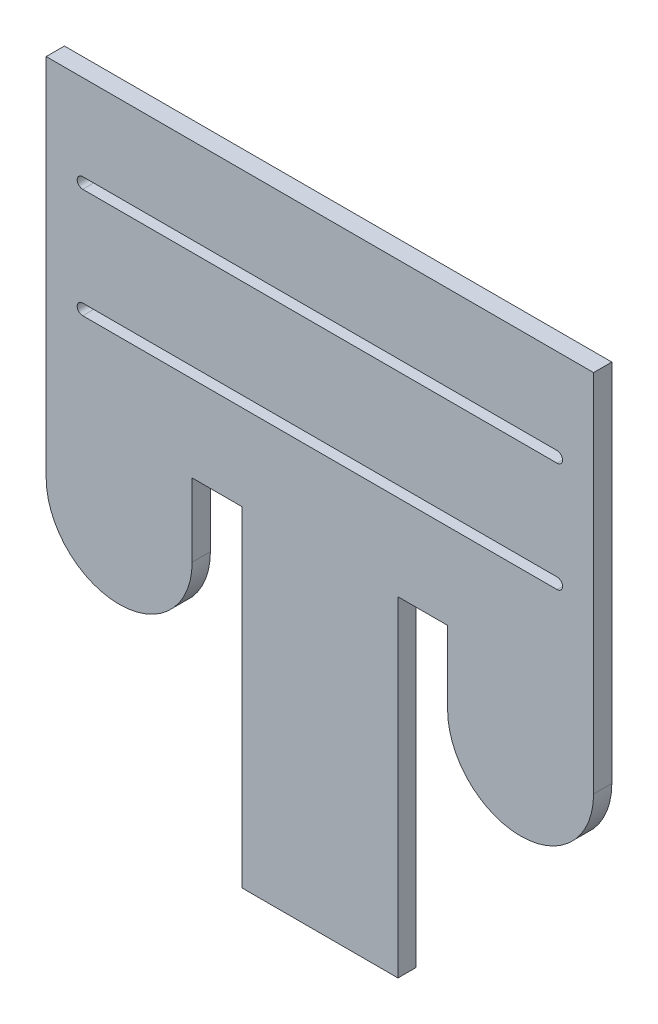
from build123d import *

# Parameters (mm, degrees)
SKETCH1_W           = 190.5
SKETCH1_H           = 6.35
BOSS_EXTRUDE1_DEPTH = 101.6
CUT_EXTRUDE1_DEPTH  = 216.993362167
SKETCH3_W           = 50.8
SKETCH3_H           = 50.8
BOSS_EXTRUDE2_DEPTH = 6.35
FILLET1_R           = 25.4
SKETCH4_W           = 54.356
SKETCH4_H           = 6.35
BOSS_EXTRUDE3_DEPTH = 114.9016


with BuildPart() as part:
    # Sketch1 → Boss-Extrude1 (new body)
    with BuildSketch(Plane(origin=(0, 0, 0), x_dir=(1, 0, 0), z_dir=(0, 1, 0))):
        with Locations((95.25, 3.175)):
            Rectangle(SKETCH1_W, SKETCH1_H)
    extrude(amount=BOSS_EXTRUDE1_DEPTH)

    # Sketch2 → Cut-Extrude1 (cut, through all)
    with BuildSketch(Plane(origin=(0, 0, -6.35), x_dir=(-1, 0, 0), z_dir=(0, 0, -1))):
        with BuildLine():
            Line((-177.8, 71.755), (-12.7, 71.755))
            ThreePointArc((-12.7, 71.755), (-10.795, 69.85), (-12.7, 67.945))
            Line((-12.7, 67.945), (-177.8, 67.945))
            ThreePointArc((-177.8, 67.945), (-179.705, 69.85), (-177.8, 71.755))
        make_face()
        with BuildLine():
            Line((-177.8, 33.655), (-12.7, 33.655))
            ThreePointArc((-12.7, 33.655), (-10.795, 31.75), (-12.7, 29.845))
            Line((-12.7, 29.845), (-177.8, 29.845))
            ThreePointArc((-177.8, 29.845), (-179.705, 31.75), (-177.8, 33.655))
        make_face()
    extrude(amount=-CUT_EXTRUDE1_DEPTH, mode=Mode.SUBTRACT)

    # Sketch3 → Boss-Extrude2 (add)
    with BuildSketch(Plane.XY):
        with Locations((25.4, -25.4)):
            Rectangle(SKETCH3_W, SKETCH3_H)
        with Locations((165.1, -25.4)):
            Rectangle(SKETCH3_W, SKETCH3_H)
    extrude(amount=-BOSS_EXTRUDE2_DEPTH)

    # Fillet1
    fillet1_edges = [part.edges().sort_by_distance(p)[0] for p in [
        (139.7, -50.8, -3.175),
        (0, -50.8, -3.175),
        (50.8, -50.8, -3.175),
        (190.5, -50.8, -3.175),
    ]]
    fillet(fillet1_edges, radius=FILLET1_R - 0.0001)  # a hair under: the kernel refuses the full size

    # Sketch4 → Boss-Extrude3 (add)
    with BuildSketch(Plane.XZ):
        with Locations((95.25, -3.175)):
            Rectangle(SKETCH4_W, SKETCH4_H)
    extrude(amount=BOSS_EXTRUDE3_DEPTH)


solid = part.part
